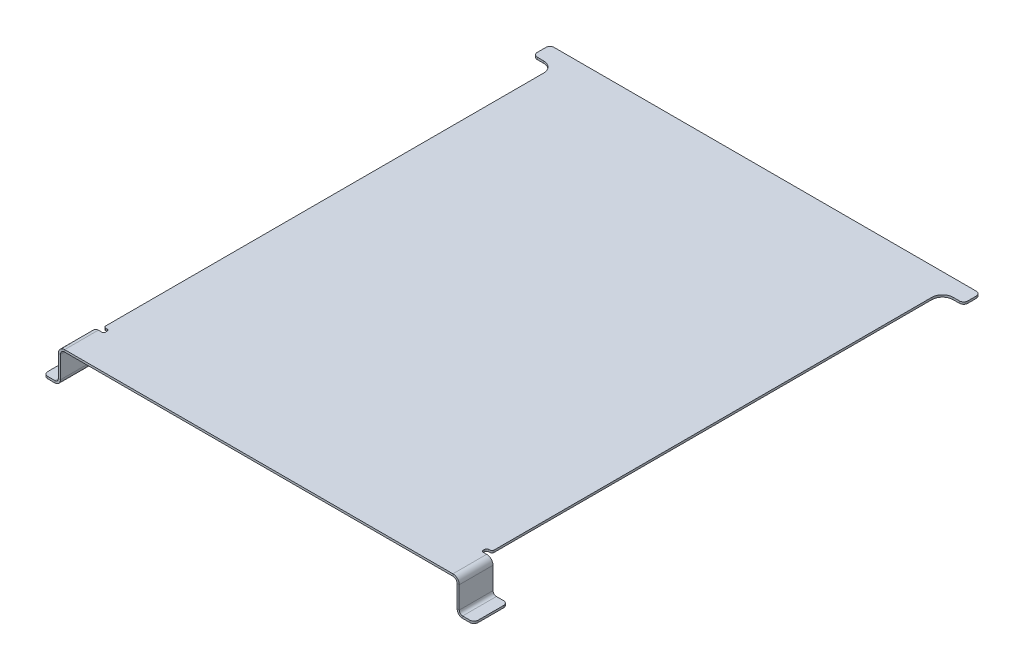
from build123d import *

# Parameters (mm, degrees)
SKETCH5_W                      = 301.625
SKETCH5_H                      = 1.5875
BASE_FLANGE1_DEPTH             = 381
SKETCH10_W                     = 11.1125
SKETCH10_H                     = 12.7
BOSS_EXTRUDE1_DEPTH            = 1.5875
EDGE_FLANGE1_STRIP_W           = 12.7
EDGE_FLANGE1_STRIP_H           = 1.5875
EDGE_FLANGE1_STRIP_CUT_DEPTH   = 368.3
EDGE_FLANGE1_STRIP_2_W         = 12.7
EDGE_FLANGE1_STRIP_2_H         = 1.5875
EDGE_FLANGE1_STRIP_CUT_2_DEPTH = 368.3
EDGE_FLANGE1_DEPTH             = 368.3
EDGE_FLANGE1_BEND_DEPTH        = 368.3
CUT_EXTRUDE1_START             = -25.4
CUT_EXTRUDE1_DEPTH             = 342.9
EDGE_FLANGE2_STRIP_W           = 11.43
EDGE_FLANGE2_STRIP_H           = 1.5875
EDGE_FLANGE2_STRIP_CUT_DEPTH   = 25.4
EDGE_FLANGE2_DEPTH             = 25.4
EDGE_FLANGE3_STRIP_W           = 11.43
EDGE_FLANGE3_STRIP_H           = 1.5875
EDGE_FLANGE3_STRIP_CUT_DEPTH   = 25.4
EDGE_FLANGE3_DEPTH             = 25.4
FILLET1_R                      = 8
FILLET2_R                      = 3.175
SKETCH30_W                     = 4
SKETCH30_H                     = 1.5875
CUT_EXTRUDE9_DEPTH             = 4
SKETCH31_W                     = 4
SKETCH31_H                     = 1.5875
CUT_EXTRUDE10_DEPTH            = 4
FILLET4_R                      = 1.5


# Sheet-metal steps are written as plain solids
with BuildPart() as part:
    # Sketch5 → Base-Flange1 (new body)
    with BuildSketch(Plane.XY):
        with Locations((0, -0.79375)):
            Rectangle(SKETCH5_W, SKETCH5_H)
    extrude(amount=BASE_FLANGE1_DEPTH)

    # Sketch10 → Boss-Extrude1 (add)
    with BuildSketch(Plane(origin=(0, 0, 0), x_dir=(1, 0, 0), z_dir=(0, 1, 0))):
        with Locations((-156.36875, -6.35)):
            Rectangle(SKETCH10_W, SKETCH10_H)
        with Locations((156.36875, -6.35)):
            Rectangle(SKETCH10_W, SKETCH10_H)
    extrude(amount=-BOSS_EXTRUDE1_DEPTH)

    # Edge-Flange1 strip (across the edge) → Edge-Flange1 strip cut (cut)
    with BuildSketch(Plane(origin=(150.8125, -1.5875, 12.7), x_dir=(-1, 0, 0), z_dir=(0, 0, 1))):
        with Locations((-1.5875, -0.79375)):
            Rectangle(EDGE_FLANGE1_STRIP_W, EDGE_FLANGE1_STRIP_H)
    extrude(amount=EDGE_FLANGE1_STRIP_CUT_DEPTH, mode=Mode.SUBTRACT)

    # Edge-Flange1 strip 2 (across the edge) → Edge-Flange1 strip cut 2 (cut)
    with BuildSketch(Plane(origin=(-150.8125, -1.5875, 381), x_dir=(1, 0, 0), z_dir=(0, 0, -1))):
        with Locations((-1.5875, -0.79375)):
            Rectangle(EDGE_FLANGE1_STRIP_2_W, EDGE_FLANGE1_STRIP_2_H)
    extrude(amount=EDGE_FLANGE1_STRIP_CUT_2_DEPTH, mode=Mode.SUBTRACT)

    # Edge-Flange1 section (across the edge) → Edge-Flange1 (add)
    with BuildSketch(Plane(origin=(150.8125, -1.5875, 12.7), x_dir=(-1, 0, 0), z_dir=(0, 0, 1))):
        with BuildLine():
            Line((0, 3.175), (0, 23.8125))
            Line((0, 23.8125), (1.5875, 23.8125))
            Line((1.5875, 23.8125), (1.5875, 3.175))
            ThreePointArc((1.5875, 3.175), (2.51743597, 0.92993597), (4.7625, 0))
            Line((4.7625, 0), (4.7625, -1.5875))
            ThreePointArc((4.7625, -1.5875), (1.394903955, -0.192596045), (0, 3.175))
        make_face()
    extrude(amount=EDGE_FLANGE1_DEPTH)

    # Edge-Flange1 section 2 (across the edge) → Edge-Flange1 bend (add)
    with BuildSketch(Plane(origin=(-150.8125, -1.5875, 381), x_dir=(1, 0, 0), z_dir=(0, 0, -1))):
        with BuildLine():
            Line((0, 3.175), (0, 23.8125))
            Line((0, 23.8125), (1.5875, 23.8125))
            Line((1.5875, 23.8125), (1.5875, 3.175))
            ThreePointArc((1.5875, 3.175), (2.51743597, 0.92993597), (4.7625, 0))
            Line((4.7625, 0), (4.7625, -1.5875))
            ThreePointArc((4.7625, -1.5875), (1.394903955, -0.192596045), (0, 3.175))
        make_face()
    extrude(amount=EDGE_FLANGE1_BEND_DEPTH)

    # Sketch20 → Cut-Extrude1 (cut)
    with BuildSketch(Plane.XY.offset(381).offset(CUT_EXTRUDE1_START)):
        with BuildLine():
            Line((-150.8125, -4.7625), (-150.8125, -25.4))
            Line((-150.8125, -25.4), (-149.225, -25.4))
            Line((-149.225, -25.4), (-149.225, -4.7625))
            ThreePointArc((-149.225, -4.7625), (-148.29506403, -2.51743597), (-146.05, -1.5875))
            Line((-146.05, -1.5875), (-146.05, 0))
            ThreePointArc((-146.05, 0), (-149.417596045, -1.394903955), (-150.8125, -4.7625))
        make_face()
        with BuildLine():
            Line((149.225, -4.7625), (149.225, -25.4))
            Line((149.225, -25.4), (150.8125, -25.4))
            Line((150.8125, -25.4), (150.8125, -4.7625))
            ThreePointArc((150.8125, -4.7625), (149.417596045, -1.394903955), (146.05, 0))
            Line((146.05, 0), (146.05, -1.5875))
            ThreePointArc((146.05, -1.5875), (148.29506403, -2.51743597), (149.225, -4.7625))
        make_face()
    extrude(amount=-CUT_EXTRUDE1_DEPTH, mode=Mode.SUBTRACT)

    # Edge-Flange2 strip (across the edge) → Edge-Flange2 strip cut (cut)
    with BuildSketch(Plane(origin=(-150.8125, -25.4, 355.6), x_dir=(0, 1, 0), z_dir=(0, 0, 1))):
        with Locations((-1.5875, -0.79375)):
            Rectangle(EDGE_FLANGE2_STRIP_W, EDGE_FLANGE2_STRIP_H)
    extrude(amount=EDGE_FLANGE2_STRIP_CUT_DEPTH, mode=Mode.SUBTRACT)

    # Edge-Flange2 section (across the edge) → Edge-Flange2 (add)
    with BuildSketch(Plane(origin=(-150.8125, -25.4, 355.6), x_dir=(0, 1, 0), z_dir=(0, 0, 1))):
        with BuildLine():
            Line((0, 2.54), (0, 11.1125))
            Line((0, 11.1125), (1.5875, 11.1125))
            Line((1.5875, 11.1125), (1.5875, 2.54))
            ThreePointArc((1.5875, 2.54), (2.331448776, 0.743948776), (4.1275, 0))
            Line((4.1275, 0), (4.1275, -1.5875))
            ThreePointArc((4.1275, -1.5875), (1.208916761, -0.378583239), (0, 2.54))
        make_face()
    extrude(amount=EDGE_FLANGE2_DEPTH)

    # Edge-Flange3 strip (across the edge) → Edge-Flange3 strip cut (cut)
    with BuildSketch(Plane(origin=(150.8125, -25.4, 381), x_dir=(0, 1, 0), z_dir=(0, 0, -1))):
        with Locations((-1.5875, -0.79375)):
            Rectangle(EDGE_FLANGE3_STRIP_W, EDGE_FLANGE3_STRIP_H)
    extrude(amount=EDGE_FLANGE3_STRIP_CUT_DEPTH, mode=Mode.SUBTRACT)

    # Edge-Flange3 section (across the edge) → Edge-Flange3 (add)
    with BuildSketch(Plane(origin=(150.8125, -25.4, 381), x_dir=(0, 1, 0), z_dir=(0, 0, -1))):
        with BuildLine():
            Line((0, 2.54), (0, 11.1125))
            Line((0, 11.1125), (1.5875, 11.1125))
            Line((1.5875, 11.1125), (1.5875, 2.54))
            ThreePointArc((1.5875, 2.54), (2.331448776, 0.743948776), (4.1275, 0))
            Line((4.1275, 0), (4.1275, -1.5875))
            ThreePointArc((4.1275, -1.5875), (1.208916761, -0.378583239), (0, 2.54))
        make_face()
    extrude(amount=EDGE_FLANGE3_DEPTH)

    # Fillet1
    fillet1_edges = [part.edges().sort_by_distance(p)[0] for p in [
        (-146.05, -0.79375, 12.7),
        (146.05, -0.79375, 12.7),
    ]]
    fillet(fillet1_edges, radius=FILLET1_R)

    # Fillet2
    fillet2_edges = [part.edges().sort_by_distance(p)[0] for p in [
        (-161.925, -0.79375, 12.7),
        (-161.925, -0.79375, 0),
        (-161.925, -24.60625, 355.6),
        (-161.925, -24.60625, 381),
        (161.925, -24.60625, 381),
        (161.925, -24.60625, 355.6),
        (161.925, -0.79375, 0),
        (161.925, -0.79375, 12.7),
    ]]
    fillet(fillet2_edges, radius=FILLET2_R)

    # Sketch30 → Cut-Extrude9 (cut)
    with BuildSketch(Plane.ZY.offset(146.05)):
        with Locations((353.6, -0.79375)):
            Rectangle(SKETCH30_W, SKETCH30_H)
    extrude(amount=-CUT_EXTRUDE9_DEPTH, mode=Mode.SUBTRACT)

    # Sketch31 → Cut-Extrude10 (cut)
    with BuildSketch(Plane(origin=(146.05, 0, 0), x_dir=(0, 0, -1), z_dir=(1, 0, 0))):
        with Locations((-353.6, -0.79375)):
            Rectangle(SKETCH31_W, SKETCH31_H)
    extrude(amount=-CUT_EXTRUDE10_DEPTH, mode=Mode.SUBTRACT)

    # Fillet4
    fillet4_edges = [part.edges().sort_by_distance(p)[0] for p in [
        (-146.05, -0.79375, 351.6),
        (-142.05, -0.79375, 351.6),
        (-142.05, -0.79375, 355.6),
        (146.05, -0.79375, 351.6),
        (142.05, -0.79375, 351.6),
        (142.05, -0.79375, 355.6),
    ]]
    fillet(fillet4_edges, radius=FILLET4_R)


solid = part.part
